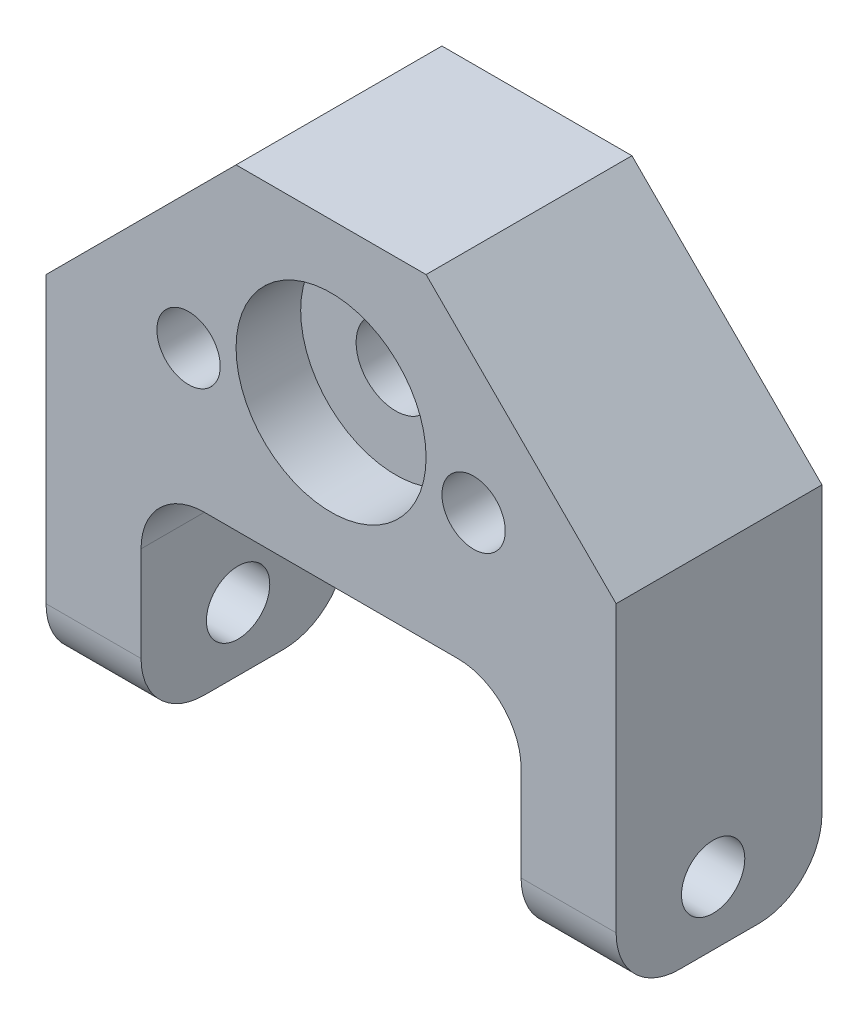
from build123d import *

# Parameters (mm, degrees)
SKETCH1_W                      = 57.15
SKETCH1_H                      = 31.75
BOSS_EXTRUDE1_DEPTH            = 20.6375
SKETCH2_R                      = 11.1125
CUT_EXTRUDE1_DEPTH             = 6.985
SKETCH3_R                      = 8.255
CUT_EXTRUDE2_DEPTH             = 2.413
SKETCH4_R                      = 3.96875
CUT_EXTRUDE3_DEPTH             = 35.56692943
CUT_EXTRUDE4_START             = -4.7625
SKETCH6_R                      = 9.525
CUT_EXTRUDE4_DEPTH             = 30.80442943
SKETCH7_W                      = 9.525
SKETCH7_H                      = 20.6375
BOSS_EXTRUDE2_DEPTH            = 22.225
SKETCH9_R                      = 3.175
CUT_EXTRUDE5_DEPTH             = 72.719166938
FILLET1_R                      = 6.35
F_1_4_0_2500_DOWEL_HOLE1_D     = 6.35
F_1_4_0_2500_DOWEL_HOLE1_DEPTH = 9.525
F_1_4_0_2500_DOWEL_HOLE1_TIP   = 1.907732465
FILLET3_R                      = 6.35
CHAMFER1_SIZE                  = 19.05


with BuildPart() as part:
    # Sketch1 → Boss-Extrude1 (new body)
    with BuildSketch(Plane.XY):
        Rectangle(SKETCH1_W, SKETCH1_H)
    extrude(amount=BOSS_EXTRUDE1_DEPTH)

    # Sketch2 → Cut-Extrude1 (cut)
    with BuildSketch(Plane(origin=(0, 0, 0), x_dir=(-1, 0, 0), z_dir=(0, 0, -1))):
        Circle(SKETCH2_R)
    extrude(amount=-CUT_EXTRUDE1_DEPTH, mode=Mode.SUBTRACT)

    # Sketch3 → Cut-Extrude2 (cut)
    with BuildSketch(Plane(origin=(0, 0, 6.985), x_dir=(-1, 0, 0), z_dir=(0, 0, -1))):
        Circle(SKETCH3_R)
    extrude(amount=-CUT_EXTRUDE2_DEPTH, mode=Mode.SUBTRACT)

    # Sketch4 → Cut-Extrude3 (cut, through all)
    with BuildSketch(Plane(origin=(0, 0, 9.398), x_dir=(-1, 0, 0), z_dir=(0, 0, -1))):
        Circle(SKETCH4_R)
    extrude(amount=-CUT_EXTRUDE3_DEPTH, mode=Mode.SUBTRACT)

    # Sketch6 → Cut-Extrude4 (cut, through all)
    with BuildSketch(Plane(origin=(0, 0, 9.398), x_dir=(-1, 0, 0), z_dir=(0, 0, -1)).offset(CUT_EXTRUDE4_START)):
        Circle(SKETCH6_R)
    extrude(amount=-CUT_EXTRUDE4_DEPTH, mode=Mode.SUBTRACT)

    # Sketch7 → Boss-Extrude2 (add)
    with BuildSketch(Plane.XZ.offset(15.875)):
        with Locations((-23.8125, 10.31875)):
            Rectangle(SKETCH7_W, SKETCH7_H)
        with Locations((23.8125, 10.31875)):
            Rectangle(SKETCH7_W, SKETCH7_H)
    extrude(amount=BOSS_EXTRUDE2_DEPTH)

    # Sketch9 → Cut-Extrude5 (cut, through all)
    with BuildSketch(Plane(origin=(28.575, 0, 0), x_dir=(0, 0, -1), z_dir=(1, 0, 0))):
        with Locations((-10.909520599, -31.75)):
            Circle(SKETCH9_R)
    extrude(amount=-CUT_EXTRUDE5_DEPTH, mode=Mode.SUBTRACT)

    # Fillet1
    fillet1_edges = [part.edges().sort_by_distance(p)[0] for p in [
        (19.05, -15.875, 10.31875),
        (-19.05, -15.875, 10.31875),
    ]]
    fillet(fillet1_edges, radius=FILLET1_R)

    # 1/4 (0.2500) Dowel Hole1
    with Locations(Plane.XY.offset(20.6375)):
        with Locations((-14.287712889, -2.413), (14.287287, -2.415520391)):
            Hole(F_1_4_0_2500_DOWEL_HOLE1_D / 2, depth=F_1_4_0_2500_DOWEL_HOLE1_DEPTH)
            with Locations((0, 0, -(F_1_4_0_2500_DOWEL_HOLE1_DEPTH + F_1_4_0_2500_DOWEL_HOLE1_TIP / 2))):  # 118° drill point
                Cone(0, F_1_4_0_2500_DOWEL_HOLE1_D / 2, F_1_4_0_2500_DOWEL_HOLE1_TIP, mode=Mode.SUBTRACT)

    # Fillet3
    fillet3_edges = [part.edges().sort_by_distance(p)[0] for p in [
        (23.8125, -38.1, 0),
        (23.8125, -38.1, 20.6375),
        (-23.8125, -38.1, 20.6375),
        (-23.8125, -38.1, 0),
    ]]
    fillet(fillet3_edges, radius=FILLET3_R)

    # Chamfer1
    chamfer1_edges = [part.edges().sort_by_distance(p)[0] for p in [
        (28.575, 15.875, 10.31875),
        (-28.575, 15.875, 10.31875),
    ]]
    chamfer(chamfer1_edges, length=CHAMFER1_SIZE)


solid = part.part
